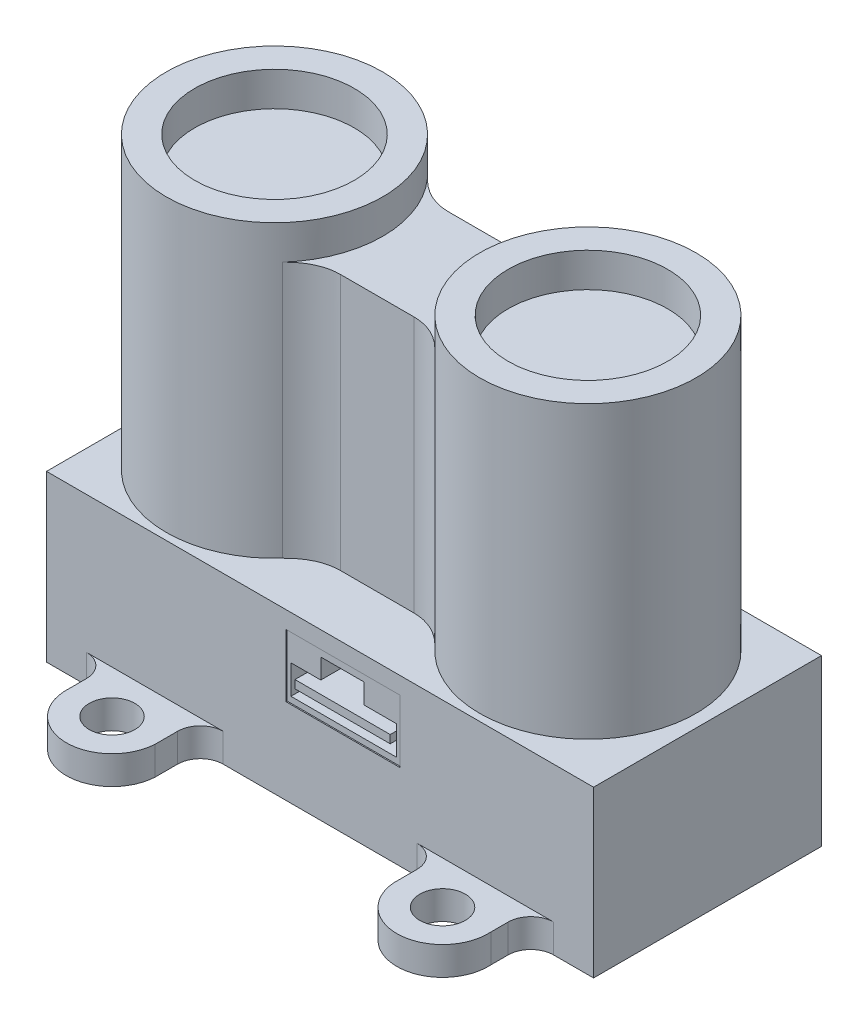
from build123d import *

# Parameters (mm, degrees)
ESQUISSE1_W                 = 48
ESQUISSE1_H                 = 20
BOSS_EXTRU_2_DEPTH          = 40
ESQUISSE1_3_R               = 2
BOSS_EXTRU_4_DEPTH          = 2.5
CONG_1_R                    = 2
ENL_V_START                 = -25.5
ENL_V_MAT_EXTRU_2_OUTLINE_W = 48
ENL_V_MAT_EXTRU_2_OUTLINE_H = 20
ENL_V_MAT_EXTRU_2_DEPTH     = 25.5
ENL_V_START_2               = -3
ENL_V_MAT_EXTRU_3_DEPTH     = 3
ESQUISSE3_5_R               = 7
ENL_V_MAT_EXTRU_4_DEPTH     = 25.5
ESQUISSE8_R                 = 7
BOSS_EXTRU_5_DEPTH          = 2
ESQUISSE9_W                 = 3.806741441
ESQUISSE9_H                 = 1.749254543
ENL_V_MAT_EXTRU_5_DEPTH     = 4
ESQUISSE9_3_W               = 9.246461273
ESQUISSE9_3_H               = 2.546264857
ESQUISSE9_3_W_2             = 8.356621676
ESQUISSE9_3_H_2             = 0.706512752
ENL_V_MAT_EXTRU_6_DEPTH     = 4
ESQUISSE9_5_W               = 10
ESQUISSE9_5_H               = 5.5
ENL_V_MAT_EXTRU_7_DEPTH     = 0.1


# Read off the part's stored shape, not the designer's step: Enlèv. mat.-Extru.2, Enlèv. mat.-Extru.3
with BuildPart() as part:
    # Esquisse1 → Boss.-Extru.2 (new body)
    with BuildSketch(Plane(origin=(0, 0, 0), x_dir=(1, 0, 0), z_dir=(0, 1, 0))):
        with Locations((24, -10)):
            Rectangle(ESQUISSE1_W, ESQUISSE1_H)
    extrude(amount=BOSS_EXTRU_2_DEPTH)

    # Esquisse1<3> → Boss.-Extru.4 (add)
    # profile 1 of 4: a face of its own
    with BuildSketch(Plane(origin=(0, 0, 0), x_dir=(1, 0, 0), z_dir=(0, 1, 0))):
        with BuildLine():
            Line((13.5, -20), (5.5, -20))
            Line((5.5, -20), (5.5, -23.5))
            ThreePointArc((5.5, -23.5), (9.25, -27.75), (13.5, -24))
            Line((13.5, -24), (13.5, -20))
        make_face()
        with Locations(Location((9.5, -23.75, 0), (0, 0, 270))):
            Circle(ESQUISSE1_3_R, mode=Mode.SUBTRACT)
    # profile 2 of 4: a face of its own
    with BuildSketch(Plane(origin=(0, 0, 0), x_dir=(1, 0, 0), z_dir=(0, 1, 0))):
        with BuildLine():
            Line((42.5, -20), (34.5, -20))
            Line((34.5, -20), (34.5, -24))
            ThreePointArc((34.5, -24), (38.75, -27.75), (42.5, -23.5))
            Line((42.5, -23.5), (42.5, -20))
        make_face()
        with Locations(Location((38.5, -23.75, 0), (0, 0, 270))):
            Circle(ESQUISSE1_3_R, mode=Mode.SUBTRACT)
    # profile 3 of 4: a face of its own
    with BuildSketch(Plane(origin=(0, 0, 0), x_dir=(1, 0, 0), z_dir=(0, 1, 0))):
        with BuildLine():
            Line((5.5, 3.5), (5.5, 0))
            Line((5.5, 0), (13.5, 0))
            Line((13.5, 0), (13.5, 4))
            ThreePointArc((13.5, 4), (9.25, 7.75), (5.5, 3.5))
        make_face()
        with Locations(Location((9.5, 3.75, 0), (0, 0, 270))):
            Circle(ESQUISSE1_3_R, mode=Mode.SUBTRACT)
    # profile 4 of 4: a face of its own
    with BuildSketch(Plane(origin=(0, 0, 0), x_dir=(1, 0, 0), z_dir=(0, 1, 0))):
        with BuildLine():
            Line((34.5, 4), (34.5, 0))
            Line((34.5, 0), (42.5, 0))
            Line((42.5, 0), (42.5, 3.5))
            ThreePointArc((42.5, 3.5), (38.75, 7.75), (34.5, 4))
        make_face()
        with Locations(Location((38.5, 3.75, 0), (0, 0, 270))):
            Circle(ESQUISSE1_3_R, mode=Mode.SUBTRACT)
    extrude(amount=BOSS_EXTRU_4_DEPTH)

    # Congé1
    cong_1_edges = [part.edges().sort_by_distance(p)[0] for p in [
        (42.5, 1.25, 0),
        (34.5, 1.25, 0),
        (13.5, 1.25, 0),
        (5.5, 1.25, 0),
        (34.5, 1.25, 20),
        (42.5, 1.25, 20),
        (13.5, 1.25, 20),
        (5.5, 1.25, 20),
    ]]
    fillet(cong_1_edges, radius=CONG_1_R)

    # Enlèv. mat.-Extru.2 outline → Enlèv. mat.-Extru.2 (cut)
    with BuildSketch(Plane(origin=(0, 40, 0), x_dir=(1, 0, 0), z_dir=(0, 1, 0)).offset(ENL_V_START)):
        with Locations((24, -10)):
            Rectangle(ENL_V_MAT_EXTRU_2_OUTLINE_W, ENL_V_MAT_EXTRU_2_OUTLINE_H)
        with BuildLine():
            add(Edge.make_bspline(
                [(16.963589169, -16.237376104), (17.999093762, -15.180393065), (19.150056624, -14.648292989), (20.416477791, -14.641075876)],
                knots=[0, 0, 0, 0, 0.986436325, 0.986436325, 0.986436325, 0.986436325], degree=3))
            ThreePointArc((16.963589169, -16.237376104), (0.394326585, -9.891075881), (16.963589169, -3.544775658))
            add(Edge.make_bspline(
                [(16.963589169, -3.544775658), (17.999093762, -4.601758697), (19.150056624, -5.133858773), (20.416477791, -5.141075886)],
                knots=[0, 0, 0, 0, 0.986436325, 0.986436325, 0.986436325, 0.986436325], degree=3))
            Line((20.416477791, -5.141075886), (26.872175379, -5.141075886))
            add(Edge.make_bspline(
                [(30.325064001, -3.544775658), (29.289559409, -4.601758697), (28.138596547, -5.133858773), (26.872175379, -5.141075886)],
                knots=[0, 0, 0, 0, 0.986436325, 0.986436325, 0.986436325, 0.986436325], degree=3))
            ThreePointArc((30.325064001, -3.544775658), (46.894326585, -9.891075881), (30.325064001, -16.237376104))
            add(Edge.make_bspline(
                [(30.325064001, -16.237376104), (29.289559409, -15.180393065), (28.138596547, -14.648292989), (26.872175379, -14.641075876)],
                knots=[0, 0, 0, 0, 0.986436325, 0.986436325, 0.986436325, 0.986436325], degree=3))
            Line((26.872175379, -14.641075876), (20.416477791, -14.641075876))
        make_face(mode=Mode.SUBTRACT)
    extrude(amount=ENL_V_MAT_EXTRU_2_DEPTH, mode=Mode.SUBTRACT)

    # Enlèv. mat.-Extru.3 outline → Enlèv. mat.-Extru.3 (cut)
    with BuildSketch(Plane(origin=(0, 40, 0), x_dir=(1, 0, 0), z_dir=(0, 1, 0)).offset(ENL_V_START_2)):
        with BuildLine():
            ThreePointArc((30.325064001, -16.237376104), (27.894326585, -9.891075881), (30.325064001, -3.544775658))
            add(Edge.make_bspline(
                [(30.325064001, -3.544775658), (29.289559409, -4.601758697), (28.138596547, -5.133858773), (26.872175379, -5.141075886)],
                knots=[0, 0, 0, 0, 0.986436325, 0.986436325, 0.986436325, 0.986436325], degree=3))
            Line((26.872175379, -5.141075886), (20.416477791, -5.141075886))
            add(Edge.make_bspline(
                [(16.963589169, -3.544775658), (17.999093762, -4.601758697), (19.150056624, -5.133858773), (20.416477791, -5.141075886)],
                knots=[0, 0, 0, 0, 0.986436325, 0.986436325, 0.986436325, 0.986436325], degree=3))
            ThreePointArc((16.963589169, -3.544775658), (19.394326585, -9.891075881), (16.963589169, -16.237376104))
            add(Edge.make_bspline(
                [(16.963589169, -16.237376104), (17.999093762, -15.180393065), (19.150056624, -14.648292989), (20.416477791, -14.641075876)],
                knots=[0, 0, 0, 0, 0.986436325, 0.986436325, 0.986436325, 0.986436325], degree=3))
            Line((20.416477791, -14.641075876), (26.872175379, -14.641075876))
            add(Edge.make_bspline(
                [(30.325064001, -16.237376104), (29.289559409, -15.180393065), (28.138596547, -14.648292989), (26.872175379, -14.641075876)],
                knots=[0, 0, 0, 0, 0.986436325, 0.986436325, 0.986436325, 0.986436325], degree=3))
        make_face()
    extrude(amount=ENL_V_MAT_EXTRU_3_DEPTH, mode=Mode.SUBTRACT)

    # Esquisse3<5> → Enlèv. mat.-Extru.4 (cut)
    with BuildSketch(Plane(origin=(0, 40, 0), x_dir=(1, 0, 0), z_dir=(0, 1, 0))):
        with Locations(Location((9.894326585, -9.891075881, 0), (0, 0, 270))):
            Circle(ESQUISSE3_5_R)
        with Locations(Location((37.394326585, -9.891075881, 0), (0, 0, 270))):
            Circle(ESQUISSE3_5_R)
    extrude(amount=-ENL_V_MAT_EXTRU_4_DEPTH, mode=Mode.SUBTRACT)

    # Esquisse8 → Boss.-Extru.5 (add)
    with BuildSketch(Plane(origin=(0, 37, 0), x_dir=(1, 0, 0), z_dir=(0, 1, 0))):
        with Locations(Location((9.894326585, -9.891075881, 0), (0, 0, 270))):
            Circle(ESQUISSE8_R)
        with Locations(Location((37.394326585, -9.891075881, 0), (0, 0, 270))):
            Circle(ESQUISSE8_R)
    extrude(amount=-BOSS_EXTRU_5_DEPTH)

    # Esquisse9 → Enlèv. mat.-Extru.5 (cut)
    with BuildSketch(Plane.XY.offset(20)):
        with Locations((25.870972193, 11.450343865)):
            Rectangle(ESQUISSE9_W, ESQUISSE9_H)
    extrude(amount=-ENL_V_MAT_EXTRU_5_DEPTH, mode=Mode.SUBTRACT)

    # Esquisse9<3> → Enlèv. mat.-Extru.6 (cut)
    with BuildSketch(Plane.XY.offset(20)):
        with Locations((25.968514368, 9.302584165)):
            Rectangle(ESQUISSE9_3_W, ESQUISSE9_3_H)
        with Locations((25.880686529, 9.127251066)):
            Rectangle(ESQUISSE9_3_W_2, ESQUISSE9_3_H_2, mode=Mode.SUBTRACT)
    extrude(amount=-ENL_V_MAT_EXTRU_6_DEPTH, mode=Mode.SUBTRACT)

    # Esquisse9<5> → Enlèv. mat.-Extru.7 (cut)
    with BuildSketch(Plane.XY.offset(20)):
        with Locations((26, 10.25)):
            Rectangle(ESQUISSE9_5_W, ESQUISSE9_5_H)
    extrude(amount=-ENL_V_MAT_EXTRU_7_DEPTH, mode=Mode.SUBTRACT)


solid = part.part
